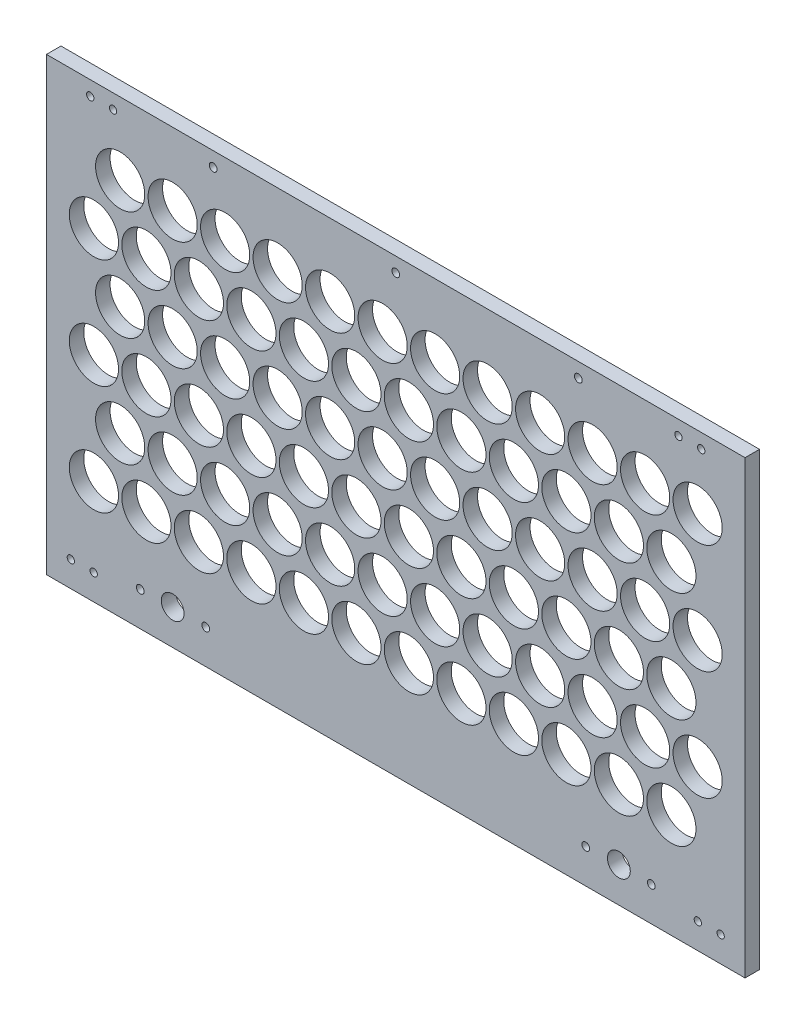
from build123d import *

# Parameters (mm, degrees)
SKETCH1_W                  = 306.05000007
SKETCH1_H                  = 197.4250001
BOSS_EXTRUDE1_DEPTH        = 6.35
CUT_EXTRUDE1_DEPTH         = 187.132543615
SKETCH4_R                  = 10.775
CUT_EXTRUDE2_DEPTH         = 187.132543615
LPATTERN1_COUNT            = 12
LPATTERN1_PITCH            = 23
LPATTERN2_COPY_1_DEPTH     = 187.132543615
LPATTERN2_COPY_2_DEPTH     = 187.132543615
LPATTERN2_COPY_3_DEPTH     = 187.132543615
LPATTERN2_COPY_4_DEPTH     = 187.132543615
LPATTERN2_COPY_5_DEPTH     = 187.132543615
LPATTERN2_COPY_6_DEPTH     = 187.132543615
LPATTERN2_COPY_7_DEPTH     = 187.132543615
LPATTERN2_COPY_8_DEPTH     = 187.132543615
LPATTERN2_COPY_9_DEPTH     = 187.132543615
LPATTERN2_COPY_10_DEPTH    = 187.132543615
LPATTERN2_COPY_11_DEPTH    = 187.132543615
LPATTERN2_COPY_12_DEPTH    = 187.132543615
LPATTERN2_COPY_13_DEPTH    = 187.132543615
LPATTERN2_COPY_14_DEPTH    = 187.132543615
LPATTERN2_COPY_15_DEPTH    = 187.132543615
LPATTERN2_COPY_16_DEPTH    = 187.132543615
LPATTERN2_COPY_17_DEPTH    = 187.132543615
LPATTERN2_COPY_18_DEPTH    = 187.132543615
LPATTERN2_COPY_19_DEPTH    = 187.132543615
LPATTERN2_COPY_20_DEPTH    = 187.132543615
LPATTERN2_COPY_21_DEPTH    = 187.132543615
LPATTERN2_COPY_22_DEPTH    = 187.132543615
LPATTERN2_COPY_23_SKETCH_R = 10.775
LPATTERN2_COPY_23_DEPTH    = 187.132543615
LPATTERN2_COPY_24_SKETCH_R = 10.775
LPATTERN2_COPY_24_DEPTH    = 187.132543615
LPATTERN2_COPY_25_SKETCH_R = 10.775
LPATTERN2_COPY_25_DEPTH    = 187.132543615
LPATTERN2_COPY_26_SKETCH_R = 10.775
LPATTERN2_COPY_26_DEPTH    = 187.132543615
LPATTERN2_COPY_27_SKETCH_R = 10.775
LPATTERN2_COPY_27_DEPTH    = 187.132543615
LPATTERN2_COPY_28_SKETCH_R = 10.775
LPATTERN2_COPY_28_DEPTH    = 187.132543615
LPATTERN2_COPY_29_SKETCH_R = 10.775
LPATTERN2_COPY_29_DEPTH    = 187.132543615
LPATTERN2_COPY_30_SKETCH_R = 10.775
LPATTERN2_COPY_30_DEPTH    = 187.132543615
LPATTERN2_COPY_31_SKETCH_R = 10.775
LPATTERN2_COPY_31_DEPTH    = 187.132543615
LPATTERN2_COPY_32_SKETCH_R = 10.775
LPATTERN2_COPY_32_DEPTH    = 187.132543615
LPATTERN2_COPY_33_SKETCH_R = 10.775
LPATTERN2_COPY_33_DEPTH    = 187.132543615
LPATTERN2_COPY_34_SKETCH_R = 10.775
LPATTERN2_COPY_34_DEPTH    = 187.132543615
LPATTERN2_COPY_35_SKETCH_R = 10.775
LPATTERN2_COPY_35_DEPTH    = 187.132543615
LPATTERN2_COPY_36_SKETCH_R = 10.775
LPATTERN2_COPY_36_DEPTH    = 187.132543615
LPATTERN2_COPY_37_SKETCH_R = 10.775
LPATTERN2_COPY_37_DEPTH    = 187.132543615
LPATTERN2_COPY_38_SKETCH_R = 10.775
LPATTERN2_COPY_38_DEPTH    = 187.132543615
LPATTERN2_COPY_39_SKETCH_R = 10.775
LPATTERN2_COPY_39_DEPTH    = 187.132543615
LPATTERN2_COPY_40_SKETCH_R = 10.775
LPATTERN2_COPY_40_DEPTH    = 187.132543615
LPATTERN2_COPY_41_SKETCH_R = 10.775
LPATTERN2_COPY_41_DEPTH    = 187.132543615
LPATTERN2_COPY_42_SKETCH_R = 10.775
LPATTERN2_COPY_42_DEPTH    = 187.132543615
LPATTERN2_COPY_43_SKETCH_R = 10.775
LPATTERN2_COPY_43_DEPTH    = 187.132543615
LPATTERN2_COPY_44_SKETCH_R = 10.775
LPATTERN2_COPY_44_DEPTH    = 187.132543615
LPATTERN2_COPY_45_DEPTH    = 187.132543615
LPATTERN2_COPY_46_DEPTH    = 187.132543615
LPATTERN2_COPY_47_SKETCH_R = 10.775
LPATTERN2_COPY_47_DEPTH    = 187.132543615
LPATTERN2_COPY_48_SKETCH_R = 10.775
LPATTERN2_COPY_48_DEPTH    = 187.132543615
SKETCH5_R                  = 5
CUT_EXTRUDE3_DEPTH         = 187.132543615
M3_CLEARANCE_HOLE1_D       = 3.4
M3_CLEARANCE_HOLE2_D       = 3.2


with BuildPart() as part:
    # Sketch1 → Boss-Extrude1 (new body)
    with BuildSketch(Plane.XY):
        with Locations((3.5e-08, -7.06250005)):
            Rectangle(SKETCH1_W, SKETCH1_H)
    extrude(amount=BOSS_EXTRUDE1_DEPTH)

    # Sketch3 → Cut-Extrude1 (cut, through all)
    with BuildSketch(Plane.XY.offset(6.35)):
        with BuildLine():
            ThreePointArc((-121.475, -60), (-132.24999993, -49.225), (-143.025, -59.999999859))
            ThreePointArc((-143.025, -59.999999859), (-139.869075617, -67.619075517), (-132.25, -70.775))
            ThreePointArc((-132.25, -70.775), (-124.630924433, -67.619075567), (-121.475, -60))
        make_face()
    cut_extrude1 = extrude(amount=-CUT_EXTRUDE1_DEPTH, mode=Mode.SUBTRACT)

    # Sketch4 → Cut-Extrude2 (cut, through all)
    with BuildSketch(Plane.XY.offset(6.35)):
        with Locations((-120.75, -36)):
            Circle(SKETCH4_R)
    cut_extrude2 = extrude(amount=-CUT_EXTRUDE2_DEPTH, mode=Mode.SUBTRACT)

    # LPattern1: Cut-Extrude1, Cut-Extrude2 ×12
    with Locations(*[(i * LPATTERN1_PITCH, 0, 0) for i in range(1, LPATTERN1_COUNT)]):
        add(cut_extrude1, mode=Mode.SUBTRACT)
        add(cut_extrude2, mode=Mode.SUBTRACT)

    # LPattern2 copy 1 sketch → LPattern2 copy 1 (cut, through all)
    with BuildSketch(Plane(origin=(23, 48, 6.35), x_dir=(1, 0, 0), z_dir=(0, 0, 1))):
        with BuildLine():
            ThreePointArc((-121.475, -60), (-132.24999993, -49.225), (-143.025, -59.999999859))
            ThreePointArc((-143.025, -59.999999859), (-139.869075617, -67.619075517), (-132.25, -70.775))
            ThreePointArc((-132.25, -70.775), (-124.630924433, -67.619075567), (-121.475, -60))
        make_face()
    extrude(amount=-LPATTERN2_COPY_1_DEPTH, mode=Mode.SUBTRACT)

    # LPattern2 copy 2 sketch → LPattern2 copy 2 (cut, through all)
    with BuildSketch(Plane(origin=(23, 96, 6.35), x_dir=(1, 0, 0), z_dir=(0, 0, 1))):
        with BuildLine():
            ThreePointArc((-121.475, -60), (-132.24999993, -49.225), (-143.025, -59.999999859))
            ThreePointArc((-143.025, -59.999999859), (-139.869075617, -67.619075517), (-132.25, -70.775))
            ThreePointArc((-132.25, -70.775), (-124.630924433, -67.619075567), (-121.475, -60))
        make_face()
    extrude(amount=-LPATTERN2_COPY_2_DEPTH, mode=Mode.SUBTRACT)

    # LPattern2 copy 3 sketch → LPattern2 copy 3 (cut, through all)
    with BuildSketch(Plane(origin=(46, 48, 6.35), x_dir=(1, 0, 0), z_dir=(0, 0, 1))):
        with BuildLine():
            ThreePointArc((-121.475, -60), (-132.24999993, -49.225), (-143.025, -59.999999859))
            ThreePointArc((-143.025, -59.999999859), (-139.869075617, -67.619075517), (-132.25, -70.775))
            ThreePointArc((-132.25, -70.775), (-124.630924433, -67.619075567), (-121.475, -60))
        make_face()
    extrude(amount=-LPATTERN2_COPY_3_DEPTH, mode=Mode.SUBTRACT)

    # LPattern2 copy 4 sketch → LPattern2 copy 4 (cut, through all)
    with BuildSketch(Plane(origin=(46, 96, 6.35), x_dir=(1, 0, 0), z_dir=(0, 0, 1))):
        with BuildLine():
            ThreePointArc((-121.475, -60), (-132.24999993, -49.225), (-143.025, -59.999999859))
            ThreePointArc((-143.025, -59.999999859), (-139.869075617, -67.619075517), (-132.25, -70.775))
            ThreePointArc((-132.25, -70.775), (-124.630924433, -67.619075567), (-121.475, -60))
        make_face()
    extrude(amount=-LPATTERN2_COPY_4_DEPTH, mode=Mode.SUBTRACT)

    # LPattern2 copy 5 sketch → LPattern2 copy 5 (cut, through all)
    with BuildSketch(Plane(origin=(69, 48, 6.35), x_dir=(1, 0, 0), z_dir=(0, 0, 1))):
        with BuildLine():
            ThreePointArc((-121.475, -60), (-132.24999993, -49.225), (-143.025, -59.999999859))
            ThreePointArc((-143.025, -59.999999859), (-139.869075617, -67.619075517), (-132.25, -70.775))
            ThreePointArc((-132.25, -70.775), (-124.630924433, -67.619075567), (-121.475, -60))
        make_face()
    extrude(amount=-LPATTERN2_COPY_5_DEPTH, mode=Mode.SUBTRACT)

    # LPattern2 copy 6 sketch → LPattern2 copy 6 (cut, through all)
    with BuildSketch(Plane(origin=(69, 96, 6.35), x_dir=(1, 0, 0), z_dir=(0, 0, 1))):
        with BuildLine():
            ThreePointArc((-121.475, -60), (-132.24999993, -49.225), (-143.025, -59.999999859))
            ThreePointArc((-143.025, -59.999999859), (-139.869075617, -67.619075517), (-132.25, -70.775))
            ThreePointArc((-132.25, -70.775), (-124.630924433, -67.619075567), (-121.475, -60))
        make_face()
    extrude(amount=-LPATTERN2_COPY_6_DEPTH, mode=Mode.SUBTRACT)

    # LPattern2 copy 7 sketch → LPattern2 copy 7 (cut, through all)
    with BuildSketch(Plane(origin=(92, 48, 6.35), x_dir=(1, 0, 0), z_dir=(0, 0, 1))):
        with BuildLine():
            ThreePointArc((-121.475, -60), (-132.24999993, -49.225), (-143.025, -59.999999859))
            ThreePointArc((-143.025, -59.999999859), (-139.869075617, -67.619075517), (-132.25, -70.775))
            ThreePointArc((-132.25, -70.775), (-124.630924433, -67.619075567), (-121.475, -60))
        make_face()
    extrude(amount=-LPATTERN2_COPY_7_DEPTH, mode=Mode.SUBTRACT)

    # LPattern2 copy 8 sketch → LPattern2 copy 8 (cut, through all)
    with BuildSketch(Plane(origin=(92, 96, 6.35), x_dir=(1, 0, 0), z_dir=(0, 0, 1))):
        with BuildLine():
            ThreePointArc((-121.475, -60), (-132.24999993, -49.225), (-143.025, -59.999999859))
            ThreePointArc((-143.025, -59.999999859), (-139.869075617, -67.619075517), (-132.25, -70.775))
            ThreePointArc((-132.25, -70.775), (-124.630924433, -67.619075567), (-121.475, -60))
        make_face()
    extrude(amount=-LPATTERN2_COPY_8_DEPTH, mode=Mode.SUBTRACT)

    # LPattern2 copy 9 sketch → LPattern2 copy 9 (cut, through all)
    with BuildSketch(Plane(origin=(115, 48, 6.35), x_dir=(1, 0, 0), z_dir=(0, 0, 1))):
        with BuildLine():
            ThreePointArc((-121.475, -60), (-132.24999993, -49.225), (-143.025, -59.999999859))
            ThreePointArc((-143.025, -59.999999859), (-139.869075617, -67.619075517), (-132.25, -70.775))
            ThreePointArc((-132.25, -70.775), (-124.630924433, -67.619075567), (-121.475, -60))
        make_face()
    extrude(amount=-LPATTERN2_COPY_9_DEPTH, mode=Mode.SUBTRACT)

    # LPattern2 copy 10 sketch → LPattern2 copy 10 (cut, through all)
    with BuildSketch(Plane(origin=(115, 96, 6.35), x_dir=(1, 0, 0), z_dir=(0, 0, 1))):
        with BuildLine():
            ThreePointArc((-121.475, -60), (-132.24999993, -49.225), (-143.025, -59.999999859))
            ThreePointArc((-143.025, -59.999999859), (-139.869075617, -67.619075517), (-132.25, -70.775))
            ThreePointArc((-132.25, -70.775), (-124.630924433, -67.619075567), (-121.475, -60))
        make_face()
    extrude(amount=-LPATTERN2_COPY_10_DEPTH, mode=Mode.SUBTRACT)

    # LPattern2 copy 11 sketch → LPattern2 copy 11 (cut, through all)
    with BuildSketch(Plane(origin=(138, 48, 6.35), x_dir=(1, 0, 0), z_dir=(0, 0, 1))):
        with BuildLine():
            ThreePointArc((-121.475, -60), (-132.24999993, -49.225), (-143.025, -59.999999859))
            ThreePointArc((-143.025, -59.999999859), (-139.869075617, -67.619075517), (-132.25, -70.775))
            ThreePointArc((-132.25, -70.775), (-124.630924433, -67.619075567), (-121.475, -60))
        make_face()
    extrude(amount=-LPATTERN2_COPY_11_DEPTH, mode=Mode.SUBTRACT)

    # LPattern2 copy 12 sketch → LPattern2 copy 12 (cut, through all)
    with BuildSketch(Plane(origin=(138, 96, 6.35), x_dir=(1, 0, 0), z_dir=(0, 0, 1))):
        with BuildLine():
            ThreePointArc((-121.475, -60), (-132.24999993, -49.225), (-143.025, -59.999999859))
            ThreePointArc((-143.025, -59.999999859), (-139.869075617, -67.619075517), (-132.25, -70.775))
            ThreePointArc((-132.25, -70.775), (-124.630924433, -67.619075567), (-121.475, -60))
        make_face()
    extrude(amount=-LPATTERN2_COPY_12_DEPTH, mode=Mode.SUBTRACT)

    # LPattern2 copy 13 sketch → LPattern2 copy 13 (cut, through all)
    with BuildSketch(Plane(origin=(161, 48, 6.35), x_dir=(1, 0, 0), z_dir=(0, 0, 1))):
        with BuildLine():
            ThreePointArc((-121.475, -60), (-132.24999993, -49.225), (-143.025, -59.999999859))
            ThreePointArc((-143.025, -59.999999859), (-139.869075617, -67.619075517), (-132.25, -70.775))
            ThreePointArc((-132.25, -70.775), (-124.630924433, -67.619075567), (-121.475, -60))
        make_face()
    extrude(amount=-LPATTERN2_COPY_13_DEPTH, mode=Mode.SUBTRACT)

    # LPattern2 copy 14 sketch → LPattern2 copy 14 (cut, through all)
    with BuildSketch(Plane(origin=(161, 96, 6.35), x_dir=(1, 0, 0), z_dir=(0, 0, 1))):
        with BuildLine():
            ThreePointArc((-121.475, -60), (-132.24999993, -49.225), (-143.025, -59.999999859))
            ThreePointArc((-143.025, -59.999999859), (-139.869075617, -67.619075517), (-132.25, -70.775))
            ThreePointArc((-132.25, -70.775), (-124.630924433, -67.619075567), (-121.475, -60))
        make_face()
    extrude(amount=-LPATTERN2_COPY_14_DEPTH, mode=Mode.SUBTRACT)

    # LPattern2 copy 15 sketch → LPattern2 copy 15 (cut, through all)
    with BuildSketch(Plane(origin=(184, 48, 6.35), x_dir=(1, 0, 0), z_dir=(0, 0, 1))):
        with BuildLine():
            ThreePointArc((-121.475, -60), (-132.24999993, -49.225), (-143.025, -59.999999859))
            ThreePointArc((-143.025, -59.999999859), (-139.869075617, -67.619075517), (-132.25, -70.775))
            ThreePointArc((-132.25, -70.775), (-124.630924433, -67.619075567), (-121.475, -60))
        make_face()
    extrude(amount=-LPATTERN2_COPY_15_DEPTH, mode=Mode.SUBTRACT)

    # LPattern2 copy 16 sketch → LPattern2 copy 16 (cut, through all)
    with BuildSketch(Plane(origin=(184, 96, 6.35), x_dir=(1, 0, 0), z_dir=(0, 0, 1))):
        with BuildLine():
            ThreePointArc((-121.475, -60), (-132.24999993, -49.225), (-143.025, -59.999999859))
            ThreePointArc((-143.025, -59.999999859), (-139.869075617, -67.619075517), (-132.25, -70.775))
            ThreePointArc((-132.25, -70.775), (-124.630924433, -67.619075567), (-121.475, -60))
        make_face()
    extrude(amount=-LPATTERN2_COPY_16_DEPTH, mode=Mode.SUBTRACT)

    # LPattern2 copy 17 sketch → LPattern2 copy 17 (cut, through all)
    with BuildSketch(Plane(origin=(207, 48, 6.35), x_dir=(1, 0, 0), z_dir=(0, 0, 1))):
        with BuildLine():
            ThreePointArc((-121.475, -60), (-132.24999993, -49.225), (-143.025, -59.999999859))
            ThreePointArc((-143.025, -59.999999859), (-139.869075617, -67.619075517), (-132.25, -70.775))
            ThreePointArc((-132.25, -70.775), (-124.630924433, -67.619075567), (-121.475, -60))
        make_face()
    extrude(amount=-LPATTERN2_COPY_17_DEPTH, mode=Mode.SUBTRACT)

    # LPattern2 copy 18 sketch → LPattern2 copy 18 (cut, through all)
    with BuildSketch(Plane(origin=(207, 96, 6.35), x_dir=(1, 0, 0), z_dir=(0, 0, 1))):
        with BuildLine():
            ThreePointArc((-121.475, -60), (-132.24999993, -49.225), (-143.025, -59.999999859))
            ThreePointArc((-143.025, -59.999999859), (-139.869075617, -67.619075517), (-132.25, -70.775))
            ThreePointArc((-132.25, -70.775), (-124.630924433, -67.619075567), (-121.475, -60))
        make_face()
    extrude(amount=-LPATTERN2_COPY_18_DEPTH, mode=Mode.SUBTRACT)

    # LPattern2 copy 19 sketch → LPattern2 copy 19 (cut, through all)
    with BuildSketch(Plane(origin=(230, 48, 6.35), x_dir=(1, 0, 0), z_dir=(0, 0, 1))):
        with BuildLine():
            ThreePointArc((-121.475, -60), (-132.24999993, -49.225), (-143.025, -59.999999859))
            ThreePointArc((-143.025, -59.999999859), (-139.869075617, -67.619075517), (-132.25, -70.775))
            ThreePointArc((-132.25, -70.775), (-124.630924433, -67.619075567), (-121.475, -60))
        make_face()
    extrude(amount=-LPATTERN2_COPY_19_DEPTH, mode=Mode.SUBTRACT)

    # LPattern2 copy 20 sketch → LPattern2 copy 20 (cut, through all)
    with BuildSketch(Plane(origin=(230, 96, 6.35), x_dir=(1, 0, 0), z_dir=(0, 0, 1))):
        with BuildLine():
            ThreePointArc((-121.475, -60), (-132.24999993, -49.225), (-143.025, -59.999999859))
            ThreePointArc((-143.025, -59.999999859), (-139.869075617, -67.619075517), (-132.25, -70.775))
            ThreePointArc((-132.25, -70.775), (-124.630924433, -67.619075567), (-121.475, -60))
        make_face()
    extrude(amount=-LPATTERN2_COPY_20_DEPTH, mode=Mode.SUBTRACT)

    # LPattern2 copy 21 sketch → LPattern2 copy 21 (cut, through all)
    with BuildSketch(Plane(origin=(253, 48, 6.35), x_dir=(1, 0, 0), z_dir=(0, 0, 1))):
        with BuildLine():
            ThreePointArc((-121.475, -60), (-132.24999993, -49.225), (-143.025, -59.999999859))
            ThreePointArc((-143.025, -59.999999859), (-139.869075617, -67.619075517), (-132.25, -70.775))
            ThreePointArc((-132.25, -70.775), (-124.630924433, -67.619075567), (-121.475, -60))
        make_face()
    extrude(amount=-LPATTERN2_COPY_21_DEPTH, mode=Mode.SUBTRACT)

    # LPattern2 copy 22 sketch → LPattern2 copy 22 (cut, through all)
    with BuildSketch(Plane(origin=(253, 96, 6.35), x_dir=(1, 0, 0), z_dir=(0, 0, 1))):
        with BuildLine():
            ThreePointArc((-121.475, -60), (-132.24999993, -49.225), (-143.025, -59.999999859))
            ThreePointArc((-143.025, -59.999999859), (-139.869075617, -67.619075517), (-132.25, -70.775))
            ThreePointArc((-132.25, -70.775), (-124.630924433, -67.619075567), (-121.475, -60))
        make_face()
    extrude(amount=-LPATTERN2_COPY_22_DEPTH, mode=Mode.SUBTRACT)

    # LPattern2 copy 23 sketch → LPattern2 copy 23 (cut, through all)
    with BuildSketch(Plane(origin=(23, 48, 6.35), x_dir=(1, 0, 0), z_dir=(0, 0, 1))):
        with Locations((-120.75, -36)):
            Circle(LPATTERN2_COPY_23_SKETCH_R)
    extrude(amount=-LPATTERN2_COPY_23_DEPTH, mode=Mode.SUBTRACT)

    # LPattern2 copy 24 sketch → LPattern2 copy 24 (cut, through all)
    with BuildSketch(Plane(origin=(23, 96, 6.35), x_dir=(1, 0, 0), z_dir=(0, 0, 1))):
        with Locations((-120.75, -36)):
            Circle(LPATTERN2_COPY_24_SKETCH_R)
    extrude(amount=-LPATTERN2_COPY_24_DEPTH, mode=Mode.SUBTRACT)

    # LPattern2 copy 25 sketch → LPattern2 copy 25 (cut, through all)
    with BuildSketch(Plane(origin=(46, 48, 6.35), x_dir=(1, 0, 0), z_dir=(0, 0, 1))):
        with Locations((-120.75, -36)):
            Circle(LPATTERN2_COPY_25_SKETCH_R)
    extrude(amount=-LPATTERN2_COPY_25_DEPTH, mode=Mode.SUBTRACT)

    # LPattern2 copy 26 sketch → LPattern2 copy 26 (cut, through all)
    with BuildSketch(Plane(origin=(46, 96, 6.35), x_dir=(1, 0, 0), z_dir=(0, 0, 1))):
        with Locations((-120.75, -36)):
            Circle(LPATTERN2_COPY_26_SKETCH_R)
    extrude(amount=-LPATTERN2_COPY_26_DEPTH, mode=Mode.SUBTRACT)

    # LPattern2 copy 27 sketch → LPattern2 copy 27 (cut, through all)
    with BuildSketch(Plane(origin=(69, 48, 6.35), x_dir=(1, 0, 0), z_dir=(0, 0, 1))):
        with Locations((-120.75, -36)):
            Circle(LPATTERN2_COPY_27_SKETCH_R)
    extrude(amount=-LPATTERN2_COPY_27_DEPTH, mode=Mode.SUBTRACT)

    # LPattern2 copy 28 sketch → LPattern2 copy 28 (cut, through all)
    with BuildSketch(Plane(origin=(69, 96, 6.35), x_dir=(1, 0, 0), z_dir=(0, 0, 1))):
        with Locations((-120.75, -36)):
            Circle(LPATTERN2_COPY_28_SKETCH_R)
    extrude(amount=-LPATTERN2_COPY_28_DEPTH, mode=Mode.SUBTRACT)

    # LPattern2 copy 29 sketch → LPattern2 copy 29 (cut, through all)
    with BuildSketch(Plane(origin=(92, 48, 6.35), x_dir=(1, 0, 0), z_dir=(0, 0, 1))):
        with Locations((-120.75, -36)):
            Circle(LPATTERN2_COPY_29_SKETCH_R)
    extrude(amount=-LPATTERN2_COPY_29_DEPTH, mode=Mode.SUBTRACT)

    # LPattern2 copy 30 sketch → LPattern2 copy 30 (cut, through all)
    with BuildSketch(Plane(origin=(92, 96, 6.35), x_dir=(1, 0, 0), z_dir=(0, 0, 1))):
        with Locations((-120.75, -36)):
            Circle(LPATTERN2_COPY_30_SKETCH_R)
    extrude(amount=-LPATTERN2_COPY_30_DEPTH, mode=Mode.SUBTRACT)

    # LPattern2 copy 31 sketch → LPattern2 copy 31 (cut, through all)
    with BuildSketch(Plane(origin=(115, 48, 6.35), x_dir=(1, 0, 0), z_dir=(0, 0, 1))):
        with Locations((-120.75, -36)):
            Circle(LPATTERN2_COPY_31_SKETCH_R)
    extrude(amount=-LPATTERN2_COPY_31_DEPTH, mode=Mode.SUBTRACT)

    # LPattern2 copy 32 sketch → LPattern2 copy 32 (cut, through all)
    with BuildSketch(Plane(origin=(115, 96, 6.35), x_dir=(1, 0, 0), z_dir=(0, 0, 1))):
        with Locations((-120.75, -36)):
            Circle(LPATTERN2_COPY_32_SKETCH_R)
    extrude(amount=-LPATTERN2_COPY_32_DEPTH, mode=Mode.SUBTRACT)

    # LPattern2 copy 33 sketch → LPattern2 copy 33 (cut, through all)
    with BuildSketch(Plane(origin=(138, 48, 6.35), x_dir=(1, 0, 0), z_dir=(0, 0, 1))):
        with Locations((-120.75, -36)):
            Circle(LPATTERN2_COPY_33_SKETCH_R)
    extrude(amount=-LPATTERN2_COPY_33_DEPTH, mode=Mode.SUBTRACT)

    # LPattern2 copy 34 sketch → LPattern2 copy 34 (cut, through all)
    with BuildSketch(Plane(origin=(138, 96, 6.35), x_dir=(1, 0, 0), z_dir=(0, 0, 1))):
        with Locations((-120.75, -36)):
            Circle(LPATTERN2_COPY_34_SKETCH_R)
    extrude(amount=-LPATTERN2_COPY_34_DEPTH, mode=Mode.SUBTRACT)

    # LPattern2 copy 35 sketch → LPattern2 copy 35 (cut, through all)
    with BuildSketch(Plane(origin=(161, 48, 6.35), x_dir=(1, 0, 0), z_dir=(0, 0, 1))):
        with Locations((-120.75, -36)):
            Circle(LPATTERN2_COPY_35_SKETCH_R)
    extrude(amount=-LPATTERN2_COPY_35_DEPTH, mode=Mode.SUBTRACT)

    # LPattern2 copy 36 sketch → LPattern2 copy 36 (cut, through all)
    with BuildSketch(Plane(origin=(161, 96, 6.35), x_dir=(1, 0, 0), z_dir=(0, 0, 1))):
        with Locations((-120.75, -36)):
            Circle(LPATTERN2_COPY_36_SKETCH_R)
    extrude(amount=-LPATTERN2_COPY_36_DEPTH, mode=Mode.SUBTRACT)

    # LPattern2 copy 37 sketch → LPattern2 copy 37 (cut, through all)
    with BuildSketch(Plane(origin=(184, 48, 6.35), x_dir=(1, 0, 0), z_dir=(0, 0, 1))):
        with Locations((-120.75, -36)):
            Circle(LPATTERN2_COPY_37_SKETCH_R)
    extrude(amount=-LPATTERN2_COPY_37_DEPTH, mode=Mode.SUBTRACT)

    # LPattern2 copy 38 sketch → LPattern2 copy 38 (cut, through all)
    with BuildSketch(Plane(origin=(184, 96, 6.35), x_dir=(1, 0, 0), z_dir=(0, 0, 1))):
        with Locations((-120.75, -36)):
            Circle(LPATTERN2_COPY_38_SKETCH_R)
    extrude(amount=-LPATTERN2_COPY_38_DEPTH, mode=Mode.SUBTRACT)

    # LPattern2 copy 39 sketch → LPattern2 copy 39 (cut, through all)
    with BuildSketch(Plane(origin=(207, 48, 6.35), x_dir=(1, 0, 0), z_dir=(0, 0, 1))):
        with Locations((-120.75, -36)):
            Circle(LPATTERN2_COPY_39_SKETCH_R)
    extrude(amount=-LPATTERN2_COPY_39_DEPTH, mode=Mode.SUBTRACT)

    # LPattern2 copy 40 sketch → LPattern2 copy 40 (cut, through all)
    with BuildSketch(Plane(origin=(207, 96, 6.35), x_dir=(1, 0, 0), z_dir=(0, 0, 1))):
        with Locations((-120.75, -36)):
            Circle(LPATTERN2_COPY_40_SKETCH_R)
    extrude(amount=-LPATTERN2_COPY_40_DEPTH, mode=Mode.SUBTRACT)

    # LPattern2 copy 41 sketch → LPattern2 copy 41 (cut, through all)
    with BuildSketch(Plane(origin=(230, 48, 6.35), x_dir=(1, 0, 0), z_dir=(0, 0, 1))):
        with Locations((-120.75, -36)):
            Circle(LPATTERN2_COPY_41_SKETCH_R)
    extrude(amount=-LPATTERN2_COPY_41_DEPTH, mode=Mode.SUBTRACT)

    # LPattern2 copy 42 sketch → LPattern2 copy 42 (cut, through all)
    with BuildSketch(Plane(origin=(230, 96, 6.35), x_dir=(1, 0, 0), z_dir=(0, 0, 1))):
        with Locations((-120.75, -36)):
            Circle(LPATTERN2_COPY_42_SKETCH_R)
    extrude(amount=-LPATTERN2_COPY_42_DEPTH, mode=Mode.SUBTRACT)

    # LPattern2 copy 43 sketch → LPattern2 copy 43 (cut, through all)
    with BuildSketch(Plane(origin=(253, 48, 6.35), x_dir=(1, 0, 0), z_dir=(0, 0, 1))):
        with Locations((-120.75, -36)):
            Circle(LPATTERN2_COPY_43_SKETCH_R)
    extrude(amount=-LPATTERN2_COPY_43_DEPTH, mode=Mode.SUBTRACT)

    # LPattern2 copy 44 sketch → LPattern2 copy 44 (cut, through all)
    with BuildSketch(Plane(origin=(253, 96, 6.35), x_dir=(1, 0, 0), z_dir=(0, 0, 1))):
        with Locations((-120.75, -36)):
            Circle(LPATTERN2_COPY_44_SKETCH_R)
    extrude(amount=-LPATTERN2_COPY_44_DEPTH, mode=Mode.SUBTRACT)

    # LPattern2 copy 45 sketch → LPattern2 copy 45 (cut, through all)
    with BuildSketch(Plane(origin=(0, 48, 6.35), x_dir=(1, 0, 0), z_dir=(0, 0, 1))):
        with BuildLine():
            ThreePointArc((-121.475, -60), (-132.24999993, -49.225), (-143.025, -59.999999859))
            ThreePointArc((-143.025, -59.999999859), (-139.869075617, -67.619075517), (-132.25, -70.775))
            ThreePointArc((-132.25, -70.775), (-124.630924433, -67.619075567), (-121.475, -60))
        make_face()
    extrude(amount=-LPATTERN2_COPY_45_DEPTH, mode=Mode.SUBTRACT)

    # LPattern2 copy 46 sketch → LPattern2 copy 46 (cut, through all)
    with BuildSketch(Plane(origin=(0, 96, 6.35), x_dir=(1, 0, 0), z_dir=(0, 0, 1))):
        with BuildLine():
            ThreePointArc((-121.475, -60), (-132.24999993, -49.225), (-143.025, -59.999999859))
            ThreePointArc((-143.025, -59.999999859), (-139.869075617, -67.619075517), (-132.25, -70.775))
            ThreePointArc((-132.25, -70.775), (-124.630924433, -67.619075567), (-121.475, -60))
        make_face()
    extrude(amount=-LPATTERN2_COPY_46_DEPTH, mode=Mode.SUBTRACT)

    # LPattern2 copy 47 sketch → LPattern2 copy 47 (cut, through all)
    with BuildSketch(Plane(origin=(0, 48, 6.35), x_dir=(1, 0, 0), z_dir=(0, 0, 1))):
        with Locations((-120.75, -36)):
            Circle(LPATTERN2_COPY_47_SKETCH_R)
    extrude(amount=-LPATTERN2_COPY_47_DEPTH, mode=Mode.SUBTRACT)

    # LPattern2 copy 48 sketch → LPattern2 copy 48 (cut, through all)
    with BuildSketch(Plane(origin=(0, 96, 6.35), x_dir=(1, 0, 0), z_dir=(0, 0, 1))):
        with Locations((-120.75, -36)):
            Circle(LPATTERN2_COPY_48_SKETCH_R)
    extrude(amount=-LPATTERN2_COPY_48_DEPTH, mode=Mode.SUBTRACT)

    # Sketch5 → Cut-Extrude3 (cut, through all)
    with BuildSketch(Plane(origin=(0, 0, 0), x_dir=(-1, 0, 0), z_dir=(0, 0, -1))):
        with Locations((-97.75, -90.3965)):
            Circle(SKETCH5_R)
    cut_extrude3 = extrude(amount=-CUT_EXTRUDE3_DEPTH, mode=Mode.SUBTRACT)

    # Mirror1: Cut-Extrude3 across plane
    add(cut_extrude3.mirror(Plane(origin=(0, 0, 0), x_dir=(0, 0, 1), z_dir=(1, 0, 0))), mode=Mode.SUBTRACT)

    # M3 Clearance Hole1 (through all)
    with Locations(Plane(origin=(0, 0, 0), x_dir=(-1, 0, 0), z_dir=(0, 0, -1))):
        with Locations((-111.94, -90.775), (-80, 85.3), (0, 85.3), (80, 85.3), (-83.25, -90.775), (111.94, -90.775), (83.25, -90.775)):
            Hole(M3_CLEARANCE_HOLE1_D / 2)

    # M3 Clearance Hole2 (through all)
    with Locations(Plane(origin=(0, 0, 0), x_dir=(-1, 0, 0), z_dir=(0, 0, -1))):
        with Locations((-142.350000066, -94.6000001), (-132.350000066, -94.6000001), (-133.850000066, 85.3), (-123.850000066, 85.3), (123.850000066, 85.3), (133.850000066, 85.3), (132.350000066, -94.6000001), (142.350000066, -94.6000001)):
            Hole(M3_CLEARANCE_HOLE2_D / 2)


solid = part.part
